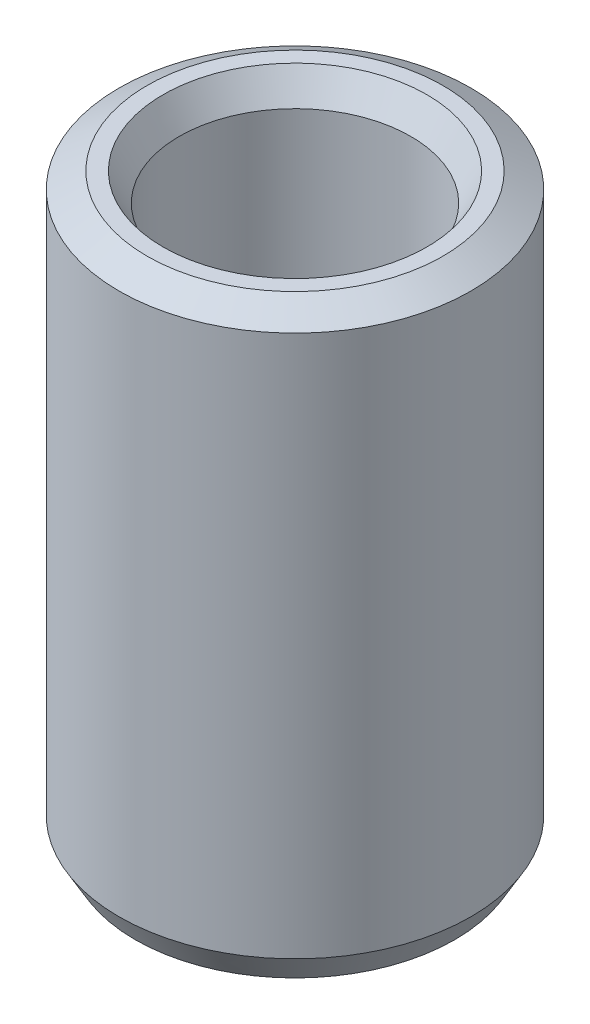
from build123d import *
from OCP.BRepFilletAPI import BRepFilletAPI_MakeChamfer

# Parameters (mm, degrees)
SKETCH1_R           = 12.5
BOSS_EXTRUDE1_DEPTH = 41.644446846
SKETCH2_R           = 8.227379456
CUT_EXTRUDE1_DEPTH  = 46.24113121
CHAMFER1_SIZE       = 1.149083558
CHAMFER1_SIZE2      = 1.990271104


with BuildPart() as part:
    # Sketch1 → Boss-Extrude1 (new body)
    with BuildSketch(Plane(origin=(0, 0, 0), x_dir=(1, 0, 0), z_dir=(0, 1, 0))):
        Circle(SKETCH1_R)
    extrude(amount=BOSS_EXTRUDE1_DEPTH)

    # Sketch2 → Cut-Extrude1 (cut, through all)
    with BuildSketch(Plane(origin=(0, 0, 0), x_dir=(1, 0, 0), z_dir=(0, 1, 0))):
        Circle(SKETCH2_R)
    extrude(amount=CUT_EXTRUDE1_DEPTH, mode=Mode.SUBTRACT)

    # Chamfer1: one chamfer whose edges measure the first distance from different faces: ONE call of the kernel's chamfer builder (chamfer() names one face for all edges)
    chamfer1_edges_1 = [part.edges().sort_by_distance(p)[0] for p in [
        (-8.227379456, 41.644446846, 0),
    ]]
    chamfer1_side_1 = [part.faces().sort_by_distance(p)[0] for p in [
        (-12.146446609, 41.644446846, 0),
    ]]
    chamfer1_edges_2 = [part.edges().sort_by_distance(p)[0] for p in [
        (-8.227379456, 0, 0),
    ]]
    chamfer1_side_2 = [part.faces().sort_by_distance(p)[0] for p in [
        (-8.227379456, 20.822223423, 0),
    ]]
    chamfer1_edges_3 = [part.edges().sort_by_distance(p)[0] for p in [
        (-12.5, 0, 0),
    ]]
    chamfer1_side_3 = [part.faces().sort_by_distance(p)[0] for p in [
        (-12.146446609, 0, 0),
    ]]
    chamfer1_edges_4 = [part.edges().sort_by_distance(p)[0] for p in [
        (-12.5, 41.644446846, 0),
    ]]
    chamfer1_side_4 = [part.faces().sort_by_distance(p)[0] for p in [
        (-12.5, 20.822223423, 0),
    ]]
    chamfer1 = BRepFilletAPI_MakeChamfer(part.part.solid().wrapped)
    for e in chamfer1_edges_1:
        chamfer1.Add(CHAMFER1_SIZE, CHAMFER1_SIZE2, e.wrapped, chamfer1_side_1[0].wrapped)  # the first distance lies on this face
    for e in chamfer1_edges_2:
        chamfer1.Add(CHAMFER1_SIZE, CHAMFER1_SIZE2, e.wrapped, chamfer1_side_2[0].wrapped)  # the first distance lies on this face
    for e in chamfer1_edges_3:
        chamfer1.Add(CHAMFER1_SIZE, CHAMFER1_SIZE2, e.wrapped, chamfer1_side_3[0].wrapped)  # the first distance lies on this face
    for e in chamfer1_edges_4:
        chamfer1.Add(CHAMFER1_SIZE, CHAMFER1_SIZE2, e.wrapped, chamfer1_side_4[0].wrapped)  # the first distance lies on this face
    add(Compound.cast(chamfer1.Shape()), mode=Mode.REPLACE)


solid = part.part
